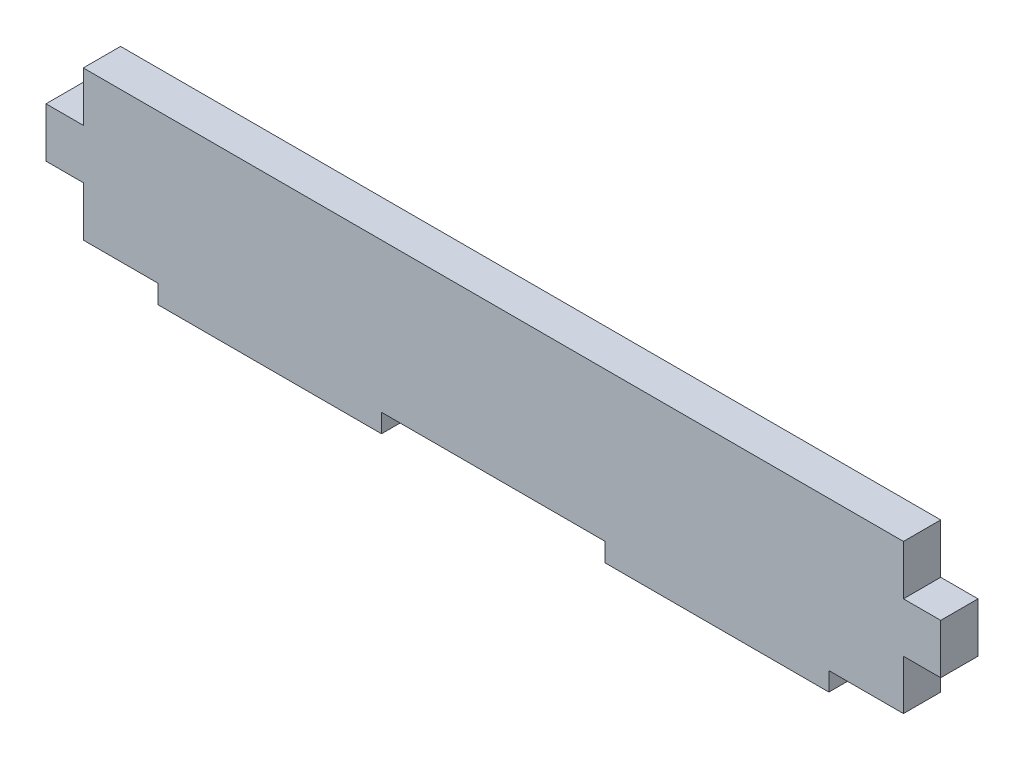
from build123d import *

# Parameters (mm, degrees)
SKETCH1_W           = 304.8
SKETCH1_H           = 50.8
BOSS_EXTRUDE1_DEPTH = 12.7
SKETCH2_W           = 76.2
SKETCH2_H           = 6.35
BOSS_EXTRUDE2_DEPTH = 12.7
SKETCH3_W           = 12.7
SKETCH3_H           = 16.933333333
CUT_EXTRUDE1_DEPTH  = 157.189348228


with BuildPart() as part:
    # Sketch1 → Boss-Extrude1 (new body)
    with BuildSketch(Plane.XY):
        Rectangle(SKETCH1_W, SKETCH1_H)
    extrude(amount=BOSS_EXTRUDE1_DEPTH)

    # Sketch2 → Boss-Extrude2 (add)
    with BuildSketch(Plane.XY.offset(12.7)):
        with Locations((-76.2, -28.575)):
            Rectangle(SKETCH2_W, SKETCH2_H)
        with Locations((76.2, -28.575)):
            Rectangle(SKETCH2_W, SKETCH2_H)
    extrude(amount=-BOSS_EXTRUDE2_DEPTH)

    # Sketch3 → Cut-Extrude1 (cut, through all)
    with BuildSketch(Plane.XY.offset(12.7)):
        with Locations((-146.05, -16.933333334)):
            Rectangle(SKETCH3_W, SKETCH3_H)
        with Locations((-146.05, 16.933333334)):
            Rectangle(SKETCH3_W, SKETCH3_H)
        with Locations((146.05, 16.933333334)):
            Rectangle(SKETCH3_W, SKETCH3_H)
        with Locations((146.05, -16.933333334)):
            Rectangle(SKETCH3_W, SKETCH3_H)
    extrude(amount=-CUT_EXTRUDE1_DEPTH, mode=Mode.SUBTRACT)


solid = part.part
